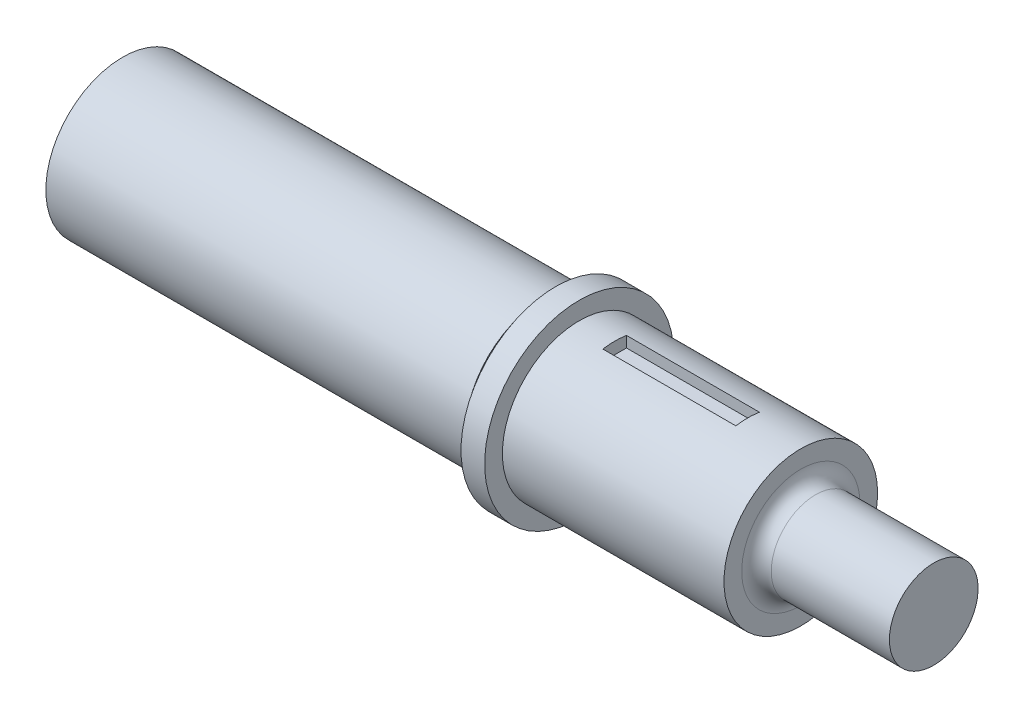
from build123d import *

# Parameters (mm, degrees)
SKETCH1_R                                = 26
BOSS_EXTRUDE1_DEPTH                      = 142
SKETCH2_R                                = 22
BOSS_EXTRUDE2_DEPTH                      = 4.5
SKETCH3_R                                = 32
BOSS_EXTRUDE3_DEPTH                      = 8
SKETCH4_R                                = 26
BOSS_EXTRUDE4_DEPTH                      = 75
F_12_0_12_DIAMETER_HOLE1_D               = 12
F_12_0_12_DIAMETER_HOLE1_DEPTH           = 23
F_12_0_12_DIAMETER_HOLE1_TIP             = 3.605163714
F_12_0_12_DIAMETER_HOLE1_ON_FACE_2_D     = 12
F_12_0_12_DIAMETER_HOLE1_ON_FACE_2_DEPTH = 23
F_12_0_12_DIAMETER_HOLE1_ON_FACE_2_TIP   = 3.605163714
SKETCH6_R                                = 15
BOSS_EXTRUDE5_DEPTH                      = 45
FILLET2_R                                = 5
CUT_EXTRUDE1_START                       = 26
SKETCH7_W                                = 45
SKETCH7_H                                = 8
CUT_EXTRUDE1_DEPTH                       = 4
M8_CLEARANCE_HOLE1_D                     = 8.4
M8_CLEARANCE_HOLE1_DEPTH                 = 13
M8_CLEARANCE_HOLE1_TIP                   = 2.5236146


with BuildPart() as part:
    # Sketch1 → Boss-Extrude1 (new body)
    with BuildSketch(Plane(origin=(0, 0, 0), x_dir=(0, 0, -1), z_dir=(1, 0, 0))):
        Circle(SKETCH1_R)
    extrude(amount=BOSS_EXTRUDE1_DEPTH)

    # Sketch2 → Boss-Extrude2 (add)
    with BuildSketch(Plane(origin=(142, 0, 0), x_dir=(0, 0, -1), z_dir=(1, 0, 0))):
        Circle(SKETCH2_R)
    extrude(amount=BOSS_EXTRUDE2_DEPTH)

    # Sketch3 → Boss-Extrude3 (add)
    with BuildSketch(Plane(origin=(146.5, 0, 0), x_dir=(0, 0, -1), z_dir=(1, 0, 0))):
        Circle(SKETCH3_R)
    extrude(amount=BOSS_EXTRUDE3_DEPTH)

    # Sketch4 → Boss-Extrude4 (add)
    with BuildSketch(Plane(origin=(154.5, 0, 0), x_dir=(0, 0, -1), z_dir=(1, 0, 0))):
        Circle(SKETCH4_R)
    extrude(amount=BOSS_EXTRUDE4_DEPTH)

    # Ø12.0 (12) Diameter Hole1
    with Locations(Plane(origin=(0, 0, 0), x_dir=(0, 0, -1), z_dir=(-1, 0, 0))):
        with Locations((0, 0)):
            Hole(F_12_0_12_DIAMETER_HOLE1_D / 2, depth=F_12_0_12_DIAMETER_HOLE1_DEPTH)
            with Locations((0, 0, -(F_12_0_12_DIAMETER_HOLE1_DEPTH + F_12_0_12_DIAMETER_HOLE1_TIP / 2))):  # 118° drill point
                Cone(0, F_12_0_12_DIAMETER_HOLE1_D / 2, F_12_0_12_DIAMETER_HOLE1_TIP, mode=Mode.SUBTRACT)

    # Ø12.0 (12) Diameter Hole1 on face 2
    with Locations(Plane(origin=(-153.563701333, 12.350945858, 0), x_dir=(0, 0, -1), z_dir=(-1, 0, 0))):
        with Locations((0, 0)):
            Hole(F_12_0_12_DIAMETER_HOLE1_ON_FACE_2_D / 2, depth=F_12_0_12_DIAMETER_HOLE1_ON_FACE_2_DEPTH)
            with Locations((0, 0, -(F_12_0_12_DIAMETER_HOLE1_ON_FACE_2_DEPTH + F_12_0_12_DIAMETER_HOLE1_ON_FACE_2_TIP / 2))):  # 118° drill point
                Cone(0, F_12_0_12_DIAMETER_HOLE1_ON_FACE_2_D / 2, F_12_0_12_DIAMETER_HOLE1_ON_FACE_2_TIP, mode=Mode.SUBTRACT)

    # Sketch6 → Boss-Extrude5 (add)
    with BuildSketch(Plane(origin=(229.5, 0, 0), x_dir=(0, 0, -1), z_dir=(1, 0, 0))):
        Circle(SKETCH6_R)
    extrude(amount=BOSS_EXTRUDE5_DEPTH)

    # Fillet2
    fillet2_edges = [part.edges().sort_by_distance(p)[0] for p in [
        (229.5, 0, 15),
    ]]
    fillet(fillet2_edges, radius=FILLET2_R)

    # Sketch7 → Cut-Extrude1 (cut)
    with BuildSketch(Plane(origin=(0, 0, 0), x_dir=(1, 0, 0), z_dir=(0, 1, 0)).offset(CUT_EXTRUDE1_START)):
        with Locations((189, 0)):
            Rectangle(SKETCH7_W, SKETCH7_H)
    extrude(amount=-CUT_EXTRUDE1_DEPTH, mode=Mode.SUBTRACT)

    # M8 Clearance Hole1
    with Locations(Plane.ZY):
        with Locations((0, -16)):
            Hole(M8_CLEARANCE_HOLE1_D / 2, depth=M8_CLEARANCE_HOLE1_DEPTH)
            with Locations((0, 0, -(M8_CLEARANCE_HOLE1_DEPTH + M8_CLEARANCE_HOLE1_TIP / 2))):  # 118° drill point
                Cone(0, M8_CLEARANCE_HOLE1_D / 2, M8_CLEARANCE_HOLE1_TIP, mode=Mode.SUBTRACT)


solid = part.part
